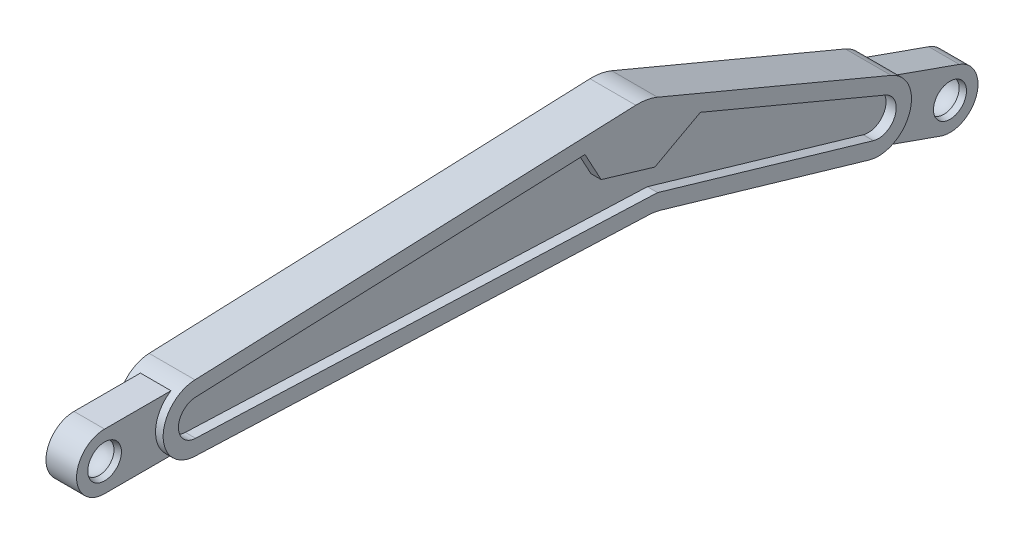
from build123d import *
from build123d.topology import SkipClean

# Parameters (mm, degrees)
SKETCH1_R           = 3.25
BOSS_EXTRUDE1_DEPTH = 3
BOSS_EXTRUDE2_START = -4.5
BOSS_EXTRUDE2_DEPTH = 9
CUT_EXTRUDE1_DEPTH  = 2
FILLET1_R           = 10
CUT_EXTRUDE2_DEPTH  = 17
CHAMFER1_SIZE       = 1.5
CHAMFER1_SIZE_2     = 1.435934089
CUT_EXTRUDE3_DEPTH  = 17
CHAMFER2_SIZE       = 1.435934089


with BuildPart() as part:
    # Sketch1 → Boss-Extrude1 (new, symmetric)
    with BuildSketch(Plane(origin=(0, 0, 0), x_dir=(0, 0, -1), z_dir=(1, 0, 0))):
        with BuildLine():
            Line((105, 10), (16.24350989, 6.494937476))
            ThreePointArc((16.24350989, 6.494937476), (14.574337558, 6.208206195), (13.035898385, 5.5))
            Line((13.035898385, 5.5), (0, 5.5))
            ThreePointArc((0, 5.5), (-5.5, 0), (0, -5.5))
            Line((0, -5.5), (13.035898385, -5.5))
            ThreePointArc((13.035898385, -5.5), (14.574337558, -6.208206195), (16.24350989, -6.494937476))
            Line((16.24350989, -6.494937476), (106.559228351, -10.061575135))
            Line((106.559228351, -10.061575135), (148.580824133, -22.31516659))
            ThreePointArc((148.580824133, -22.31516659), (150.199105044, -22.57193923), (151.830180598, -22.41586927))
            Line((151.830180598, -22.41586927), (164.118536879, -26.766840037))
            ThreePointArc((164.118536879, -26.766840037), (171.138866131, -23.417963033), (167.789989128, -16.397633781))
            Line((167.789989128, -16.397633781), (155.501632847, -12.046663013))
            ThreePointArc((155.501632847, -12.046663013), (154.332173391, -10.899000225), (152.912873821, -10.08024872))
            Line((152.912873821, -10.08024872), (105, 10))
        make_face()
        Circle(SKETCH1_R, mode=Mode.SUBTRACT)
        with Locations((165.954263003, -21.582236909)):
            Circle(SKETCH1_R, mode=Mode.SUBTRACT)
    extrude(amount=BOSS_EXTRUDE1_DEPTH, both=True)

    # Boss-Extrude2: read off the stored shape, not the designer's step
    # Boss-Extrude2 outline → Boss-Extrude2 (add)
    with SkipClean():  # the faces are left unmerged after this step: merging them gives an invalid solid
        with BuildSketch(Plane(origin=(0, 0, 0), x_dir=(0, 0, -1), z_dir=(1, 0, 0)).offset(BOSS_EXTRUDE2_START)):
            with BuildLine():
                ThreePointArc((148.580824133, -22.31516659), (156.527711861, -18.244553046), (152.912873821, -10.08024872))
                Line((152.912873821, -10.08024872), (105, 10))
                Line((105, 10), (16.24350989, 6.494937476))
                ThreePointArc((16.24350989, 6.494937476), (10, 0), (16.24350989, -6.494937476))
                Line((16.24350989, -6.494937476), (106.559228351, -10.061575135))
                Line((106.559228351, -10.061575135), (148.580824133, -22.31516659))
            make_face()
        extrude(amount=BOSS_EXTRUDE2_DEPTH)

    # Sketch2 → Cut-Extrude1 (cut)
    with SkipClean():  # the faces are left unmerged after this step: merging them gives an invalid solid
        with BuildSketch(Plane(origin=(4.5, 0, 0), x_dir=(0, 0, -1), z_dir=(1, 0, 0))):
            with BuildLine():
                Line((95.980965998, 0.663794286), (92.809228462, 6.516238621))
                Line((92.809228462, 6.516238621), (16.361889941, 3.497274026))
                ThreePointArc((16.361889941, 3.497274026), (13, 0), (16.361889941, -3.497274026))
                Line((16.361889941, -3.497274026), (107.045551003, -7.078442023))
                Line((107.045551003, -7.078442023), (149.420653126, -19.435116719))
                ThreePointArc((149.420653126, -19.435116719), (153.699746519, -17.243247888), (151.753295266, -12.847084019))
                Line((151.753295266, -12.847084019), (115.449531272, 2.367795664))
                Line((115.449531272, 2.367795664), (106.52555447, -2.46856169))
                Line((106.52555447, -2.46856169), (95.980965998, 0.663794286))
            make_face()
        cut_extrude1 = extrude(amount=-CUT_EXTRUDE1_DEPTH, mode=Mode.SUBTRACT)

    # Mirror1: Cut-Extrude1 across plane
    with SkipClean():  # the faces are left unmerged after this step: merging them gives an invalid solid
        add(cut_extrude1.mirror(Plane(origin=(0, 0, 0), x_dir=(0, 0, 1), z_dir=(1, 0, 0))), mode=Mode.SUBTRACT)

    # Fillet1
    fillet1_edges = [part.edges().sort_by_distance(p)[0] for p in [
        (0, -10.061575135, -106.559228351),
        (0, 10, -105),
    ]]
    fillet(fillet1_edges, radius=FILLET1_R)

    # Sketch3 → Revolve1 (revolve)
    with SkipClean():  # the faces are left unmerged after this step: merging them gives an invalid solid
        with BuildSketch(Plane(origin=(0, 0, 0), x_dir=(0, 0, -1), z_dir=(1, 0, 0))):
            with BuildLine():
                ThreePointArc((4.5, 0), (0, 4.5), (-4.5, 0))
                Line((-4.5, 0), (-3.5, 0))
                ThreePointArc((-3.5, 0), (0, 3.5), (3.5, 0))
                Line((3.5, 0), (4.5, 0))
            make_face()
        revolve(axis=Axis((0, 0, 4.5), (0, 0, -1)))

    # Sketch4 → Cut-Extrude2 (cut)
    with SkipClean():  # the faces are left unmerged after this step: merging them gives an invalid solid
        with BuildSketch(Plane(origin=(0, 5.5, 0), x_dir=(1, 0, 0), z_dir=(0, 1, 0))):
            Polygon((3, 0), (3, -6.291238928), (6.747077204, -6.291238928), (6.747077204, 6.985365783), (3, 6.985365783), align=None)
            Polygon((-5.881309599, 6.985365783), (-5.881309599, -6.291238928), (-3, -6.291238928), (-3, 0), (-3, 6.985365783), align=None)
        extrude(amount=-CUT_EXTRUDE2_DEPTH, mode=Mode.SUBTRACT)

    # Chamfer1
    # the kernel refuses this chamfer: 1.5, 1.435934089 mm, written as the material it takes off along each edge
    with BuildSketch(Plane(origin=(3, 0, 0), x_dir=(0, 0, -1), z_dir=(0, 1, 0))) as chamfer1_piece_1:
        with BuildLine():
            Line((1.802775638 + CHAMFER1_SIZE, 0), (2.915614393, 1.063716779))
            ThreePointArc((2.915614393, 1.063716779), (2.427398497, 0.478544758), (1.802775638, 0))
            Line((1.802775638, 0), (1.802775638 + CHAMFER1_SIZE, 0))
        make_face()
    revolve(axis=Axis((3, 0, 0), (-1, 0, 0)), mode=Mode.SUBTRACT)
    with BuildSketch(Plane(origin=(-3, 0, 0), x_dir=(0, 0, 1), z_dir=(0, 1, 0))) as chamfer1_piece_2:
        with BuildLine():
            Line((1.802775638 + CHAMFER1_SIZE_2, 0), (3.00448024, 1.204701004))
            ThreePointArc((3.00448024, 1.204701004), (2.490248254, 0.540596895), (1.802775638, 0))
            Line((1.802775638, 0), (1.802775638 + CHAMFER1_SIZE_2, 0))
        make_face()
    revolve(axis=Axis((-3, 0, 0), (1, 0, 0)), mode=Mode.SUBTRACT)

    # Sketch5 → Revolve2 (revolve)
    with SkipClean():  # the faces are left unmerged after this step: merging them gives an invalid solid
        with BuildSketch(Plane(origin=(0, 0, 0), x_dir=(0, 0, -1), z_dir=(1, 0, 0))):
            with BuildLine():
                Line((169.454263003, -21.582236909), (170.454263003, -21.582236909))
                ThreePointArc((170.454263003, -21.582236909), (165.954263003, -17.082236909), (161.454263003, -21.582236909))
                Line((161.454263003, -21.582236909), (162.454263003, -21.582236909))
                ThreePointArc((162.454263003, -21.582236909), (165.954263003, -18.082236909), (169.454263003, -21.582236909))
            make_face()
        revolve(axis=Axis((0, -21.582236909, -170.454263003), (0, 0, 1)))

    # Sketch6 → Cut-Extrude3 (cut)
    with SkipClean():  # the faces are left unmerged after this step: merging them gives an invalid solid
        with BuildSketch(Plane(origin=(0, 38.220593136, -13.532866369), x_dir=(1, 0, 0), z_dir=(0, 0.9426551142039149, -0.33376838625790206))):
            Polygon((-6.767171252, 154.311979975), (-3, 154.311979975), (-3, 163.641103129), (-3, 169.141103129), (3, 169.141103129), (3, 154.311979975), (6.783794008, 154.311979975), (6.783794008, 170.859793321), (-6.767171252, 170.859793321), align=None)
        extrude(amount=-CUT_EXTRUDE3_DEPTH, mode=Mode.SUBTRACT)

    # Chamfer2
    # the kernel refuses this chamfer: 1.5, 1.435934089 mm, written as the material it takes off along each edge
    with BuildSketch(Plane(origin=(3, -21.582236909, -165.954263003), x_dir=(0, 0, -1), z_dir=(0, 1, 0))) as chamfer2_piece_1:
        with BuildLine():
            Line((1.802775638 + CHAMFER2_SIZE, 0), (3.00448024, 1.204701004))
            ThreePointArc((3.00448024, 1.204701004), (2.490248254, 0.540596895), (1.802775638, 0))
            Line((1.802775638, 0), (1.802775638 + CHAMFER2_SIZE, 0))
        make_face()
    revolve(axis=Axis((3, -21.582236909, -165.954263003), (-1, 0, 0)), mode=Mode.SUBTRACT)
    with BuildSketch(Plane(origin=(-3, -21.582236909, -165.954263003), x_dir=(0, 0, 1), z_dir=(0, 1, 0))) as chamfer2_piece_2:
        with BuildLine():
            Line((1.802775638 + CHAMFER2_SIZE, 0), (3.00448024, 1.204701004))
            ThreePointArc((3.00448024, 1.204701004), (2.490248254, 0.540596895), (1.802775638, 0))
            Line((1.802775638, 0), (1.802775638 + CHAMFER2_SIZE, 0))
        make_face()
    revolve(axis=Axis((-3, -21.582236909, -165.954263003), (1, 0, 0)), mode=Mode.SUBTRACT)

    # Sketch5<6> → Cut-Revolve1 (revolve, cut)
    with SkipClean():  # the faces are left unmerged after this step: merging them gives an invalid solid
        with BuildSketch(Plane(origin=(0, 0, 0), x_dir=(0, 0, -1), z_dir=(1, 0, 0))):
            with BuildLine():
                Line((162.454263003, -21.582236909), (169.454263003, -21.582236909))
                ThreePointArc((169.454263003, -21.582236909), (165.954263003, -18.082236909), (162.454263003, -21.582236909))
            make_face()
        revolve(axis=Axis((0, -21.582236909, -170.454263003), (0, 0, 1)), mode=Mode.SUBTRACT)

    # Sketch3<6> → Cut-Revolve2 (revolve, cut)
    with SkipClean():  # the faces are left unmerged after this step: merging them gives an invalid solid
        with BuildSketch(Plane(origin=(0, 0, 0), x_dir=(0, 0, -1), z_dir=(1, 0, 0))):
            with BuildLine():
                ThreePointArc((3.5, 0), (0, 3.5), (-3.5, 0))
                Line((-3.5, 0), (3.5, 0))
            make_face()
        revolve(axis=Axis((0, 0, 4.5), (0, 0, -1)), mode=Mode.SUBTRACT)


solid = part.part
